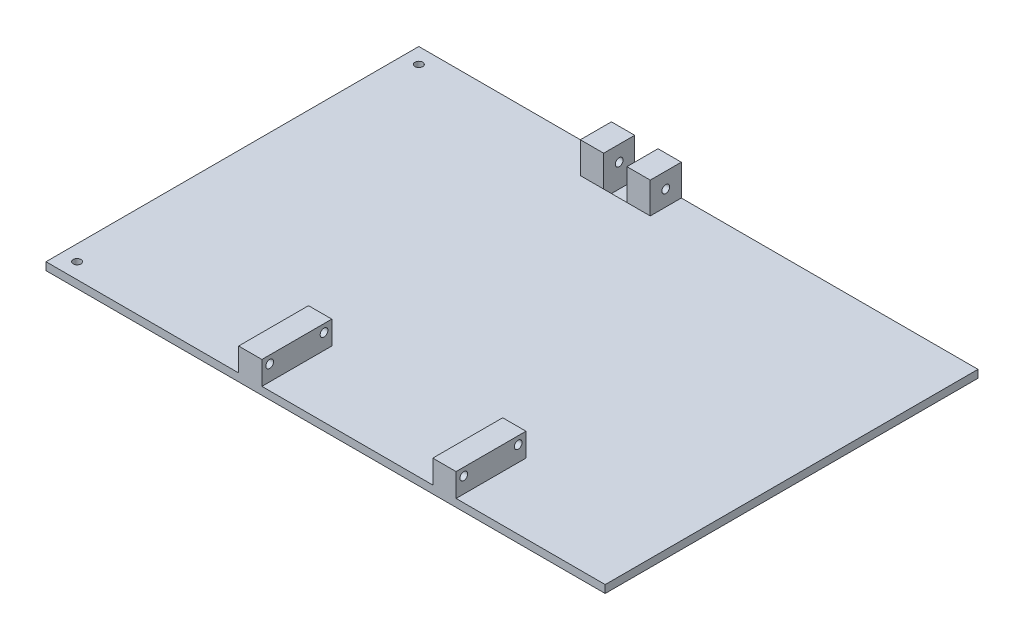
from build123d import *

# Parameters (mm, degrees)
SKETCH1_W            = 457.2
SKETCH1_H            = 304.8
BOSS_EXTRUDE1_DEPTH  = 6.35
SKETCH6_W            = 19.05
SKETCH6_H            = 57.15
BOSS_EXTRUDE3_DEPTH  = 19.05
SKETCH7_R            = 3.175
CUT_EXTRUDE1_DEPTH   = 370.166085116
SKETCH15_R           = 3.175
CUT_EXTRUDE3_DEPTH   = 276.402655216
SKETCH16_W           = 19.05
SKETCH16_H           = 25.4
BOSS_EXTRUDE6_DEPTH  = 25.4
SKETCH17_R           = 3.175
CUT_EXTRUDE4_DEPTH   = 289.225653612
SKETCH18_W           = 19.05
SKETCH18_H           = 25.4
CUT_EXTRUDE5_DEPTH   = 6.35
SKETCH20_W           = 57.15
SKETCH20_H           = 44.45
BOSS_EXTRUDE10_DEPTH = 6.35


with BuildPart() as part:
    # Sketch1 → Boss-Extrude1 (new body)
    with BuildSketch(Plane(origin=(0, 0, 0), x_dir=(1, 0, 0), z_dir=(0, 1, 0))):
        Rectangle(SKETCH1_W, SKETCH1_H)
    extrude(amount=BOSS_EXTRUDE1_DEPTH)

    # Sketch6 → Boss-Extrude3 (add)
    with BuildSketch(Plane(origin=(0, 6.35, 0), x_dir=(1, 0, 0), z_dir=(0, 1, 0))):
        with Locations((97.155, -123.825)):
            Rectangle(SKETCH6_W, SKETCH6_H)
        with Locations((-61.595, -123.825)):
            Rectangle(SKETCH6_W, SKETCH6_H)
    extrude(amount=BOSS_EXTRUDE3_DEPTH)

    # Sketch7 → Cut-Extrude1 (cut, through all)
    with BuildSketch(Plane(origin=(106.68, 0, 0), x_dir=(0, 0, -1), z_dir=(1, 0, 0))):
        with Locations((-101.6, 19.05)):
            Circle(SKETCH7_R)
        with Locations((-146.05, 19.05)):
            Circle(SKETCH7_R)
    extrude(amount=-CUT_EXTRUDE1_DEPTH, mode=Mode.SUBTRACT)

    # Sketch15 → Cut-Extrude3 (cut, through all)
    with BuildSketch(Plane(origin=(0, 6.35, 0), x_dir=(1, 0, 0), z_dir=(0, 1, 0))):
        with Locations((-215.9, -139.7)):
            Circle(SKETCH15_R)
        with Locations((-215.9, 139.7)):
            Circle(SKETCH15_R)
    extrude(amount=-CUT_EXTRUDE3_DEPTH, mode=Mode.SUBTRACT)

    # Sketch16 → Boss-Extrude6 (add)
    with BuildSketch(Plane(origin=(0, 6.35, 0), x_dir=(1, 0, 0), z_dir=(0, 1, 0))):
        with Locations((-61.595, 139.7)):
            Rectangle(SKETCH16_W, SKETCH16_H)
        with Locations((-23.495, 139.7)):
            Rectangle(SKETCH16_W, SKETCH16_H)
    extrude(amount=BOSS_EXTRUDE6_DEPTH)

    # Sketch17 → Cut-Extrude4 (cut, through all)
    with BuildSketch(Plane(origin=(-13.97, 0, 0), x_dir=(0, 0, -1), z_dir=(1, 0, 0))):
        with Locations((139.7, 19.05)):
            Circle(SKETCH17_R)
    extrude(amount=-CUT_EXTRUDE4_DEPTH, mode=Mode.SUBTRACT)

    # Sketch18 → Cut-Extrude5 (cut)
    with BuildSketch(Plane(origin=(0, 6.35, 0), x_dir=(1, 0, 0), z_dir=(0, 1, 0))):
        with Locations((-42.545, 139.7)):
            Rectangle(SKETCH18_W, SKETCH18_H)
    extrude(amount=-CUT_EXTRUDE5_DEPTH, mode=Mode.SUBTRACT)

    # Sketch20 → Boss-Extrude10 (add)
    with BuildSketch(Plane.XZ):
        with Locations((-42.545, -130.175)):
            Rectangle(SKETCH20_W, SKETCH20_H)
    extrude(amount=BOSS_EXTRUDE10_DEPTH)


solid = part.part
